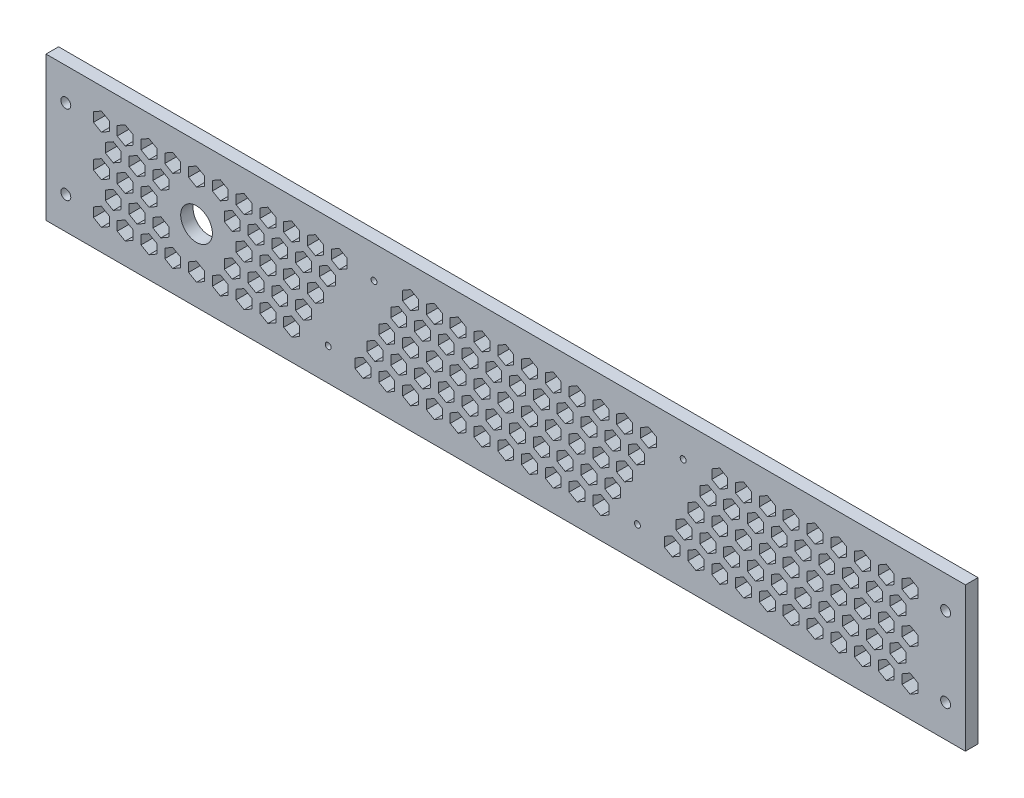
from build123d import *

# Parameters (mm, degrees)
SKETCH1_W           = 463.88
SKETCH1_H           = 72.7
BOSS_EXTRUDE1_DEPTH = 6.35
SKETCH4_R           = 2.5
CUT_EXTRUDE3_DEPTH  = 449.658653544
SKETCH5_W           = 423.88
SKETCH5_H           = 60
CUT_EXTRUDE4_DEPTH  = 0.1
FILL_START          = 192.1
FILL_PATTERN1_DEPTH = 6.25
SKETCH7_R           = 8
CUT_EXTRUDE5_DEPTH  = 449.658653544
SKETCH8_R           = 1.5
CUT_EXTRUDE6_DEPTH  = 449.658653544


with BuildPart() as part:
    # Sketch1 → Boss-Extrude1 (new body)
    with BuildSketch(Plane.XY.offset(192)):
        with Locations((211.74, 30)):
            Rectangle(SKETCH1_W, SKETCH1_H)
    extrude(amount=BOSS_EXTRUDE1_DEPTH)

    # Sketch4 → Cut-Extrude3 (cut, through all)
    with BuildSketch(Plane.XY.offset(198.35)):
        with Locations((-10.2, 50)):
            Circle(SKETCH4_R)
        with Locations((-10.2, 10)):
            Circle(SKETCH4_R)
        with Locations((433.68, 50)):
            Circle(SKETCH4_R)
        with Locations((433.68, 10)):
            Circle(SKETCH4_R)
    extrude(amount=-CUT_EXTRUDE3_DEPTH, mode=Mode.SUBTRACT)

    # Sketch5 → Cut-Extrude4 (cut)
    with BuildSketch(Plane(origin=(0, 0, 192), x_dir=(-1, 0, 0), z_dir=(0, 0, -1))):
        with Locations((-211.74, 30)):
            Rectangle(SKETCH5_W, SKETCH5_H)
    extrude(amount=-CUT_EXTRUDE4_DEPTH, mode=Mode.SUBTRACT)

    # Fill Pattern1: read off the stored shape, not the designer's step
    # Fill Pattern1 outline → Fill Pattern1 (cut)
    with BuildSketch(Plane.XY.offset(FILL_START)):
        Polygon((7.74, 4.596588156), (11.74, 6.905989232), (11.74, 11.524791386), (7.74, 13.834192463), (3.74, 11.524791386), (3.74, 6.905989232), align=None)
        Polygon((79.74, 46.165807537), (83.74, 48.475208614), (83.74, 53.094010768), (79.74, 55.403411844), (75.74, 53.094010768), (75.74, 48.475208614), align=None)
        Polygon((25.74, 14.988893001), (29.74, 17.298294078), (29.74, 21.917096231), (25.74, 24.226497308), (21.74, 21.917096231), (21.74, 17.298294078), align=None)
        Polygon((3.74, 53.094010768), (3.74, 48.475208614), (7.74, 46.165807537), (11.74, 48.475208614), (11.74, 53.094010768), (7.74, 55.403411844), align=None)
        Polygon((3.74, 32.309401077), (3.74, 27.690598923), (7.74, 25.381197846), (11.74, 27.690598923), (11.74, 32.309401077), (7.74, 34.618802153), align=None)
        Polygon((415.74, 4.596588156), (419.74, 6.905989232), (419.74, 11.524791386), (415.74, 13.834192463), (411.74, 11.524791386), (411.74, 6.905989232), align=None)
        Polygon((357.74, 38.082903769), (361.74, 35.773502692), (365.74, 38.082903769), (365.74, 42.701705922), (361.74, 45.011106999), (357.74, 42.701705922), align=None)
        Polygon((339.74, 48.475208614), (343.74, 46.165807537), (347.74, 48.475208614), (347.74, 53.094010768), (343.74, 55.403411844), (339.74, 53.094010768), align=None)
        Polygon((393.74, 17.298294078), (397.74, 14.988893001), (401.74, 17.298294078), (401.74, 21.917096231), (397.74, 24.226497308), (393.74, 21.917096231), align=None)
        Polygon((375.74, 27.690598923), (379.74, 25.381197846), (383.74, 27.690598923), (383.74, 32.309401077), (379.74, 34.618802153), (375.74, 32.309401077), align=None)
        Polygon((411.74, 53.094010768), (411.74, 48.475208614), (415.74, 46.165807537), (419.74, 48.475208614), (419.74, 53.094010768), (415.74, 55.403411844), align=None)
        Polygon((411.74, 32.309401077), (411.74, 27.690598923), (415.74, 25.381197846), (419.74, 27.690598923), (419.74, 32.309401077), (415.74, 34.618802153), align=None)
        Polygon((403.74, 4.596588156), (407.74, 6.905989232), (407.74, 11.524791386), (403.74, 13.834192463), (399.74, 11.524791386), (399.74, 6.905989232), align=None)
        Polygon((345.74, 38.082903769), (349.74, 35.773502692), (353.74, 38.082903769), (353.74, 42.701705922), (349.74, 45.011106999), (345.74, 42.701705922), align=None)
        Polygon((327.74, 48.475208614), (331.74, 46.165807537), (335.74, 48.475208614), (335.74, 53.094010768), (331.74, 55.403411844), (327.74, 53.094010768), align=None)
        Polygon((381.74, 17.298294078), (385.74, 14.988893001), (389.74, 17.298294078), (389.74, 21.917096231), (385.74, 24.226497308), (381.74, 21.917096231), align=None)
        Polygon((363.74, 27.690598923), (367.74, 25.381197846), (371.74, 27.690598923), (371.74, 32.309401077), (367.74, 34.618802153), (363.74, 32.309401077), align=None)
        Polygon((399.74, 53.094010768), (399.74, 48.475208614), (403.74, 46.165807537), (407.74, 48.475208614), (407.74, 53.094010768), (403.74, 55.403411844), align=None)
        Polygon((399.74, 32.309401077), (399.74, 27.690598923), (403.74, 25.381197846), (407.74, 27.690598923), (407.74, 32.309401077), (403.74, 34.618802153), align=None)
        Polygon((391.74, 4.596588156), (395.74, 6.905989232), (395.74, 11.524791386), (391.74, 13.834192463), (387.74, 11.524791386), (387.74, 6.905989232), align=None)
        Polygon((409.74, 14.988893001), (413.74, 17.298294078), (413.74, 21.917096231), (409.74, 24.226497308), (405.74, 21.917096231), (405.74, 17.298294078), align=None)
        Polygon((333.74, 38.082903769), (337.74, 35.773502692), (341.74, 38.082903769), (341.74, 42.701705922), (337.74, 45.011106999), (333.74, 42.701705922), align=None)
        Polygon((315.74, 48.475208614), (319.74, 46.165807537), (323.74, 48.475208614), (323.74, 53.094010768), (319.74, 55.403411844), (315.74, 53.094010768), align=None)
        Polygon((369.74, 17.298294078), (373.74, 14.988893001), (377.74, 17.298294078), (377.74, 21.917096231), (373.74, 24.226497308), (369.74, 21.917096231), align=None)
        Polygon((351.74, 27.690598923), (355.74, 25.381197846), (359.74, 27.690598923), (359.74, 32.309401077), (355.74, 34.618802153), (351.74, 32.309401077), align=None)
        Polygon((387.74, 53.094010768), (387.74, 48.475208614), (391.74, 46.165807537), (395.74, 48.475208614), (395.74, 53.094010768), (391.74, 55.403411844), align=None)
        Polygon((387.74, 32.309401077), (387.74, 27.690598923), (391.74, 25.381197846), (395.74, 27.690598923), (395.74, 32.309401077), (391.74, 34.618802153), align=None)
        Polygon((379.74, 4.596588156), (383.74, 6.905989232), (383.74, 11.524791386), (379.74, 13.834192463), (375.74, 11.524791386), (375.74, 6.905989232), align=None)
        Polygon((321.74, 38.082903769), (325.74, 35.773502692), (329.74, 38.082903769), (329.74, 42.701705922), (325.74, 45.011106999), (321.74, 42.701705922), align=None)
        Polygon((357.74, 17.298294078), (361.74, 14.988893001), (365.74, 17.298294078), (365.74, 21.917096231), (361.74, 24.226497308), (357.74, 21.917096231), align=None)
        Polygon((339.74, 27.690598923), (343.74, 25.381197846), (347.74, 27.690598923), (347.74, 32.309401077), (343.74, 34.618802153), (339.74, 32.309401077), align=None)
        Polygon((375.74, 53.094010768), (375.74, 48.475208614), (379.74, 46.165807537), (383.74, 48.475208614), (383.74, 53.094010768), (379.74, 55.403411844), align=None)
        Polygon((367.74, 4.596588156), (371.74, 6.905989232), (371.74, 11.524791386), (367.74, 13.834192463), (363.74, 11.524791386), (363.74, 6.905989232), align=None)
        Polygon((309.74, 38.082903769), (313.74, 35.773502692), (317.74, 38.082903769), (317.74, 42.701705922), (313.74, 45.011106999), (309.74, 42.701705922), align=None)
        Polygon((345.74, 17.298294078), (349.74, 14.988893001), (353.74, 17.298294078), (353.74, 21.917096231), (349.74, 24.226497308), (345.74, 21.917096231), align=None)
        Polygon((327.74, 27.690598923), (331.74, 25.381197846), (335.74, 27.690598923), (335.74, 32.309401077), (331.74, 34.618802153), (327.74, 32.309401077), align=None)
        Polygon((363.74, 53.094010768), (363.74, 48.475208614), (367.74, 46.165807537), (371.74, 48.475208614), (371.74, 53.094010768), (367.74, 55.403411844), align=None)
        Polygon((355.74, 4.596588156), (359.74, 6.905989232), (359.74, 11.524791386), (355.74, 13.834192463), (351.74, 11.524791386), (351.74, 6.905989232), align=None)
        Polygon((409.74, 35.773502692), (413.74, 38.082903769), (413.74, 42.701705922), (409.74, 45.011106999), (405.74, 42.701705922), (405.74, 38.082903769), align=None)
        Polygon((279.74, 48.475208614), (283.74, 46.165807537), (287.74, 48.475208614), (287.74, 53.094010768), (283.74, 55.403411844), (279.74, 53.094010768), align=None)
        Polygon((333.74, 17.298294078), (337.74, 14.988893001), (341.74, 17.298294078), (341.74, 21.917096231), (337.74, 24.226497308), (333.74, 21.917096231), align=None)
        Polygon((315.74, 27.690598923), (319.74, 25.381197846), (323.74, 27.690598923), (323.74, 32.309401077), (319.74, 34.618802153), (315.74, 32.309401077), align=None)
        Polygon((351.74, 53.094010768), (351.74, 48.475208614), (355.74, 46.165807537), (359.74, 48.475208614), (359.74, 53.094010768), (355.74, 55.403411844), align=None)
        Polygon((343.74, 4.596588156), (347.74, 6.905989232), (347.74, 11.524791386), (343.74, 13.834192463), (339.74, 11.524791386), (339.74, 6.905989232), align=None)
        Polygon((397.74, 35.773502692), (401.74, 38.082903769), (401.74, 42.701705922), (397.74, 45.011106999), (393.74, 42.701705922), (393.74, 38.082903769), align=None)
        Polygon((267.74, 48.475208614), (271.74, 46.165807537), (275.74, 48.475208614), (275.74, 53.094010768), (271.74, 55.403411844), (267.74, 53.094010768), align=None)
        Polygon((321.74, 17.298294078), (325.74, 14.988893001), (329.74, 17.298294078), (329.74, 21.917096231), (325.74, 24.226497308), (321.74, 21.917096231), align=None)
        Polygon((303.74, 27.690598923), (307.74, 25.381197846), (311.74, 27.690598923), (311.74, 32.309401077), (307.74, 34.618802153), (303.74, 32.309401077), align=None)
        Polygon((331.74, 4.596588156), (335.74, 6.905989232), (335.74, 11.524791386), (331.74, 13.834192463), (327.74, 11.524791386), (327.74, 6.905989232), align=None)
        Polygon((385.74, 35.773502692), (389.74, 38.082903769), (389.74, 42.701705922), (385.74, 45.011106999), (381.74, 42.701705922), (381.74, 38.082903769), align=None)
        Polygon((273.74, 38.082903769), (277.74, 35.773502692), (281.74, 38.082903769), (281.74, 42.701705922), (277.74, 45.011106999), (273.74, 42.701705922), align=None)
        Polygon((255.74, 48.475208614), (259.74, 46.165807537), (263.74, 48.475208614), (263.74, 53.094010768), (259.74, 55.403411844), (255.74, 53.094010768), align=None)
        Polygon((309.74, 17.298294078), (313.74, 14.988893001), (317.74, 17.298294078), (317.74, 21.917096231), (313.74, 24.226497308), (309.74, 21.917096231), align=None)
        Polygon((319.74, 4.596588156), (323.74, 6.905989232), (323.74, 11.524791386), (319.74, 13.834192463), (315.74, 11.524791386), (315.74, 6.905989232), align=None)
        Polygon((373.74, 35.773502692), (377.74, 38.082903769), (377.74, 42.701705922), (373.74, 45.011106999), (369.74, 42.701705922), (369.74, 38.082903769), align=None)
        Polygon((261.74, 38.082903769), (265.74, 35.773502692), (269.74, 38.082903769), (269.74, 42.701705922), (265.74, 45.011106999), (261.74, 42.701705922), align=None)
        Polygon((243.74, 48.475208614), (247.74, 46.165807537), (251.74, 48.475208614), (251.74, 53.094010768), (247.74, 55.403411844), (243.74, 53.094010768), align=None)
        Polygon((297.74, 17.298294078), (301.74, 14.988893001), (305.74, 17.298294078), (305.74, 21.917096231), (301.74, 24.226497308), (297.74, 21.917096231), align=None)
        Polygon((307.74, 4.596588156), (311.74, 6.905989232), (311.74, 11.524791386), (307.74, 13.834192463), (303.74, 11.524791386), (303.74, 6.905989232), align=None)
        Polygon((249.74, 38.082903769), (253.74, 35.773502692), (257.74, 38.082903769), (257.74, 42.701705922), (253.74, 45.011106999), (249.74, 42.701705922), align=None)
        Polygon((231.74, 48.475208614), (235.74, 46.165807537), (239.74, 48.475208614), (239.74, 53.094010768), (235.74, 55.403411844), (231.74, 53.094010768), align=None)
        Polygon((267.74, 27.690598923), (271.74, 25.381197846), (275.74, 27.690598923), (275.74, 32.309401077), (271.74, 34.618802153), (267.74, 32.309401077), align=None)
        Polygon((295.74, 4.596588156), (299.74, 6.905989232), (299.74, 11.524791386), (295.74, 13.834192463), (291.74, 11.524791386), (291.74, 6.905989232), align=None)
        Polygon((237.74, 38.082903769), (241.74, 35.773502692), (245.74, 38.082903769), (245.74, 42.701705922), (241.74, 45.011106999), (237.74, 42.701705922), align=None)
        Polygon((219.74, 48.475208614), (223.74, 46.165807537), (227.74, 48.475208614), (227.74, 53.094010768), (223.74, 55.403411844), (219.74, 53.094010768), align=None)
        Polygon((255.74, 27.690598923), (259.74, 25.381197846), (263.74, 27.690598923), (263.74, 32.309401077), (259.74, 34.618802153), (255.74, 32.309401077), align=None)
        Polygon((259.74, 4.596588156), (263.74, 6.905989232), (263.74, 11.524791386), (259.74, 13.834192463), (255.74, 11.524791386), (255.74, 6.905989232), align=None)
        Polygon((201.74, 38.082903769), (205.74, 35.773502692), (209.74, 38.082903769), (209.74, 42.701705922), (205.74, 45.011106999), (201.74, 42.701705922), align=None)
        Polygon((183.74, 48.475208614), (187.74, 46.165807537), (191.74, 48.475208614), (191.74, 53.094010768), (187.74, 55.403411844), (183.74, 53.094010768), align=None)
        Polygon((237.74, 17.298294078), (241.74, 14.988893001), (245.74, 17.298294078), (245.74, 21.917096231), (241.74, 24.226497308), (237.74, 21.917096231), align=None)
        Polygon((219.74, 27.690598923), (223.74, 25.381197846), (227.74, 27.690598923), (227.74, 32.309401077), (223.74, 34.618802153), (219.74, 32.309401077), align=None)
        Polygon((247.74, 4.596588156), (251.74, 6.905989232), (251.74, 11.524791386), (247.74, 13.834192463), (243.74, 11.524791386), (243.74, 6.905989232), align=None)
        Polygon((265.74, 14.988893001), (269.74, 17.298294078), (269.74, 21.917096231), (265.74, 24.226497308), (261.74, 21.917096231), (261.74, 17.298294078), align=None)
        Polygon((189.74, 38.082903769), (193.74, 35.773502692), (197.74, 38.082903769), (197.74, 42.701705922), (193.74, 45.011106999), (189.74, 42.701705922), align=None)
        Polygon((171.74, 48.475208614), (175.74, 46.165807537), (179.74, 48.475208614), (179.74, 53.094010768), (175.74, 55.403411844), (171.74, 53.094010768), align=None)
        Polygon((225.74, 17.298294078), (229.74, 14.988893001), (233.74, 17.298294078), (233.74, 21.917096231), (229.74, 24.226497308), (225.74, 21.917096231), align=None)
        Polygon((207.74, 27.690598923), (211.74, 25.381197846), (215.74, 27.690598923), (215.74, 32.309401077), (211.74, 34.618802153), (207.74, 32.309401077), align=None)
        Polygon((243.74, 32.309401077), (243.74, 27.690598923), (247.74, 25.381197846), (251.74, 27.690598923), (251.74, 32.309401077), (247.74, 34.618802153), align=None)
        Polygon((235.74, 4.596588156), (239.74, 6.905989232), (239.74, 11.524791386), (235.74, 13.834192463), (231.74, 11.524791386), (231.74, 6.905989232), align=None)
        Polygon((253.74, 14.988893001), (257.74, 17.298294078), (257.74, 21.917096231), (253.74, 24.226497308), (249.74, 21.917096231), (249.74, 17.298294078), align=None)
        Polygon((177.74, 38.082903769), (181.74, 35.773502692), (185.74, 38.082903769), (185.74, 42.701705922), (181.74, 45.011106999), (177.74, 42.701705922), align=None)
        Polygon((159.74, 48.475208614), (163.74, 46.165807537), (167.74, 48.475208614), (167.74, 53.094010768), (163.74, 55.403411844), (159.74, 53.094010768), align=None)
        Polygon((213.74, 17.298294078), (217.74, 14.988893001), (221.74, 17.298294078), (221.74, 21.917096231), (217.74, 24.226497308), (213.74, 21.917096231), align=None)
        Polygon((195.74, 27.690598923), (199.74, 25.381197846), (203.74, 27.690598923), (203.74, 32.309401077), (199.74, 34.618802153), (195.74, 32.309401077), align=None)
        Polygon((231.74, 32.309401077), (231.74, 27.690598923), (235.74, 25.381197846), (239.74, 27.690598923), (239.74, 32.309401077), (235.74, 34.618802153), align=None)
        Polygon((223.74, 4.596588156), (227.74, 6.905989232), (227.74, 11.524791386), (223.74, 13.834192463), (219.74, 11.524791386), (219.74, 6.905989232), align=None)
        Polygon((165.74, 38.082903769), (169.74, 35.773502692), (173.74, 38.082903769), (173.74, 42.701705922), (169.74, 45.011106999), (165.74, 42.701705922), align=None)
        Polygon((201.74, 17.298294078), (205.74, 14.988893001), (209.74, 17.298294078), (209.74, 21.917096231), (205.74, 24.226497308), (201.74, 21.917096231), align=None)
        Polygon((183.74, 27.690598923), (187.74, 25.381197846), (191.74, 27.690598923), (191.74, 32.309401077), (187.74, 34.618802153), (183.74, 32.309401077), align=None)
        Polygon((211.74, 4.596588156), (215.74, 6.905989232), (215.74, 11.524791386), (211.74, 13.834192463), (207.74, 11.524791386), (207.74, 6.905989232), align=None)
        Polygon((153.74, 38.082903769), (157.74, 35.773502692), (161.74, 38.082903769), (161.74, 42.701705922), (157.74, 45.011106999), (153.74, 42.701705922), align=None)
        Polygon((189.74, 17.298294078), (193.74, 14.988893001), (197.74, 17.298294078), (197.74, 21.917096231), (193.74, 24.226497308), (189.74, 21.917096231), align=None)
        Polygon((171.74, 27.690598923), (175.74, 25.381197846), (179.74, 27.690598923), (179.74, 32.309401077), (175.74, 34.618802153), (171.74, 32.309401077), align=None)
        Polygon((207.74, 53.094010768), (207.74, 48.475208614), (211.74, 46.165807537), (215.74, 48.475208614), (215.74, 53.094010768), (211.74, 55.403411844), align=None)
        Polygon((199.74, 4.596588156), (203.74, 6.905989232), (203.74, 11.524791386), (199.74, 13.834192463), (195.74, 11.524791386), (195.74, 6.905989232), align=None)
        Polygon((123.74, 48.475208614), (127.74, 46.165807537), (131.74, 48.475208614), (131.74, 53.094010768), (127.74, 55.403411844), (123.74, 53.094010768), align=None)
        Polygon((177.74, 17.298294078), (181.74, 14.988893001), (185.74, 17.298294078), (185.74, 21.917096231), (181.74, 24.226497308), (177.74, 21.917096231), align=None)
        Polygon((159.74, 27.690598923), (163.74, 25.381197846), (167.74, 27.690598923), (167.74, 32.309401077), (163.74, 34.618802153), (159.74, 32.309401077), align=None)
        Polygon((195.74, 53.094010768), (195.74, 48.475208614), (199.74, 46.165807537), (203.74, 48.475208614), (203.74, 53.094010768), (199.74, 55.403411844), align=None)
        Polygon((13.74, 14.988893001), (17.74, 17.298294078), (17.74, 21.917096231), (13.74, 24.226497308), (9.74, 21.917096231), (9.74, 17.298294078), align=None)
        Polygon((31.74, 25.381197846), (35.74, 27.690598923), (35.74, 32.309401077), (31.74, 34.618802153), (27.74, 32.309401077), (27.74, 27.690598923), align=None)
        Polygon((67.74, 46.165807537), (71.74, 48.475208614), (71.74, 53.094010768), (67.74, 55.403411844), (63.74, 53.094010768), (63.74, 48.475208614), align=None)
        Polygon((27.74, 6.905989232), (31.74, 4.596588156), (35.74, 6.905989232), (35.74, 11.524791386), (31.74, 13.834192463), (27.74, 11.524791386), align=None)
        Polygon((9.74, 42.701705922), (9.74, 38.082903769), (13.74, 35.773502692), (17.74, 38.082903769), (17.74, 42.701705922), (13.74, 45.011106999), align=None)
        Polygon((31.74, 46.165807537), (35.74, 48.475208614), (35.74, 53.094010768), (31.74, 55.403411844), (27.74, 53.094010768), (27.74, 48.475208614), align=None)
        Polygon((63.74, 6.905989232), (67.74, 4.596588156), (71.74, 6.905989232), (71.74, 11.524791386), (67.74, 13.834192463), (63.74, 11.524791386), align=None)
        Polygon((25.74, 35.773502692), (29.74, 38.082903769), (29.74, 42.701705922), (25.74, 45.011106999), (21.74, 42.701705922), (21.74, 38.082903769), align=None)
        Polygon((43.74, 46.165807537), (47.74, 48.475208614), (47.74, 53.094010768), (43.74, 55.403411844), (39.74, 53.094010768), (39.74, 48.475208614), align=None)
        Polygon((75.74, 6.905989232), (79.74, 4.596588156), (83.74, 6.905989232), (83.74, 11.524791386), (79.74, 13.834192463), (75.74, 11.524791386), align=None)
        Polygon((37.74, 35.773502692), (41.74, 38.082903769), (41.74, 42.701705922), (37.74, 45.011106999), (33.74, 42.701705922), (33.74, 38.082903769), align=None)
        Polygon((19.74, 25.381197846), (23.74, 27.690598923), (23.74, 32.309401077), (19.74, 34.618802153), (15.74, 32.309401077), (15.74, 27.690598923), align=None)
        Polygon((55.74, 46.165807537), (59.74, 48.475208614), (59.74, 53.094010768), (55.74, 55.403411844), (51.74, 53.094010768), (51.74, 48.475208614), align=None)
        Polygon((15.74, 48.475208614), (19.74, 46.165807537), (23.74, 48.475208614), (23.74, 53.094010768), (19.74, 55.403411844), (15.74, 53.094010768), align=None)
        Polygon((87.74, 6.905989232), (91.74, 4.596588156), (95.74, 6.905989232), (95.74, 11.524791386), (91.74, 13.834192463), (87.74, 11.524791386), align=None)
        Polygon((69.74, 17.298294078), (73.74, 14.988893001), (77.74, 17.298294078), (77.74, 21.917096231), (73.74, 24.226497308), (69.74, 21.917096231), align=None)
        Polygon((33.74, 21.917096231), (33.74, 17.298294078), (37.74, 14.988893001), (41.74, 17.298294078), (41.74, 21.917096231), (37.74, 24.226497308), align=None)
        Polygon((73.74, 35.773502692), (77.74, 38.082903769), (77.74, 42.701705922), (73.74, 45.011106999), (69.74, 42.701705922), (69.74, 38.082903769), align=None)
        Polygon((19.74, 4.596588156), (23.74, 6.905989232), (23.74, 11.524791386), (19.74, 13.834192463), (15.74, 11.524791386), (15.74, 6.905989232), align=None)
        Polygon((91.74, 46.165807537), (95.74, 48.475208614), (95.74, 53.094010768), (91.74, 55.403411844), (87.74, 53.094010768), (87.74, 48.475208614), align=None)
        Polygon((87.74, 27.690598923), (91.74, 25.381197846), (95.74, 27.690598923), (95.74, 32.309401077), (91.74, 34.618802153), (87.74, 32.309401077), align=None)
        Polygon((105.74, 17.298294078), (109.74, 14.988893001), (113.74, 17.298294078), (113.74, 21.917096231), (109.74, 24.226497308), (105.74, 21.917096231), align=None)
        Polygon((85.74, 35.773502692), (89.74, 38.082903769), (89.74, 42.701705922), (85.74, 45.011106999), (81.74, 42.701705922), (81.74, 38.082903769), align=None)
        Polygon((103.74, 46.165807537), (107.74, 48.475208614), (107.74, 53.094010768), (103.74, 55.403411844), (99.74, 53.094010768), (99.74, 48.475208614), align=None)
        Polygon((135.74, 6.905989232), (139.74, 4.596588156), (143.74, 6.905989232), (143.74, 11.524791386), (139.74, 13.834192463), (135.74, 11.524791386), align=None)
        Polygon((99.74, 27.690598923), (103.74, 25.381197846), (107.74, 27.690598923), (107.74, 32.309401077), (103.74, 34.618802153), (99.74, 32.309401077), align=None)
        Polygon((81.74, 21.917096231), (81.74, 17.298294078), (85.74, 14.988893001), (89.74, 17.298294078), (89.74, 21.917096231), (85.74, 24.226497308), align=None)
        Polygon((97.74, 35.773502692), (101.74, 38.082903769), (101.74, 42.701705922), (97.74, 45.011106999), (93.74, 42.701705922), (93.74, 38.082903769), align=None)
        Polygon((115.74, 46.165807537), (119.74, 48.475208614), (119.74, 53.094010768), (115.74, 55.403411844), (111.74, 53.094010768), (111.74, 48.475208614), align=None)
        Polygon((43.74, 4.596588156), (47.74, 6.905989232), (47.74, 11.524791386), (43.74, 13.834192463), (39.74, 11.524791386), (39.74, 6.905989232), align=None)
        Polygon((79.74, 25.381197846), (83.74, 27.690598923), (83.74, 32.309401077), (79.74, 34.618802153), (75.74, 32.309401077), (75.74, 27.690598923), align=None)
        Polygon((147.74, 6.905989232), (151.74, 4.596588156), (155.74, 6.905989232), (155.74, 11.524791386), (151.74, 13.834192463), (147.74, 11.524791386), align=None)
        Polygon((111.74, 27.690598923), (115.74, 25.381197846), (119.74, 27.690598923), (119.74, 32.309401077), (115.74, 34.618802153), (111.74, 32.309401077), align=None)
        Polygon((93.74, 21.917096231), (93.74, 17.298294078), (97.74, 14.988893001), (101.74, 17.298294078), (101.74, 21.917096231), (97.74, 24.226497308), align=None)
        Polygon((109.74, 35.773502692), (113.74, 38.082903769), (113.74, 42.701705922), (109.74, 45.011106999), (105.74, 42.701705922), (105.74, 38.082903769), align=None)
        Polygon((55.74, 4.596588156), (59.74, 6.905989232), (59.74, 11.524791386), (55.74, 13.834192463), (51.74, 11.524791386), (51.74, 6.905989232), align=None)
        Polygon((159.74, 6.905989232), (163.74, 4.596588156), (167.74, 6.905989232), (167.74, 11.524791386), (163.74, 13.834192463), (159.74, 11.524791386), align=None)
        Polygon((141.74, 17.298294078), (145.74, 14.988893001), (149.74, 17.298294078), (149.74, 21.917096231), (145.74, 24.226497308), (141.74, 21.917096231), align=None)
        Polygon((121.74, 35.773502692), (125.74, 38.082903769), (125.74, 42.701705922), (121.74, 45.011106999), (117.74, 42.701705922), (117.74, 38.082903769), align=None)
        Polygon((153.74, 17.298294078), (157.74, 14.988893001), (161.74, 17.298294078), (161.74, 21.917096231), (157.74, 24.226497308), (153.74, 21.917096231), align=None)
        Polygon((171.74, 6.905989232), (175.74, 4.596588156), (179.74, 6.905989232), (179.74, 11.524791386), (175.74, 13.834192463), (171.74, 11.524791386), align=None)
        Polygon((103.74, 4.596588156), (107.74, 6.905989232), (107.74, 11.524791386), (103.74, 13.834192463), (99.74, 11.524791386), (99.74, 6.905989232), align=None)
        Polygon((151.74, 25.381197846), (155.74, 27.690598923), (155.74, 32.309401077), (151.74, 34.618802153), (147.74, 32.309401077), (147.74, 27.690598923), align=None)
        Polygon((165.74, 21.917096231), (165.74, 17.298294078), (169.74, 14.988893001), (173.74, 17.298294078), (173.74, 21.917096231), (169.74, 24.226497308), align=None)
        Polygon((217.74, 35.773502692), (221.74, 38.082903769), (221.74, 42.701705922), (217.74, 45.011106999), (213.74, 42.701705922), (213.74, 38.082903769), align=None)
        Polygon((229.74, 35.773502692), (233.74, 38.082903769), (233.74, 42.701705922), (229.74, 45.011106999), (225.74, 42.701705922), (225.74, 38.082903769), align=None)
        Polygon((187.74, 4.596588156), (191.74, 6.905989232), (191.74, 11.524791386), (187.74, 13.834192463), (183.74, 11.524791386), (183.74, 6.905989232), align=None)
    extrude(amount=FILL_PATTERN1_DEPTH, mode=Mode.SUBTRACT)

    # Sketch7 → Cut-Extrude5 (cut, through all)
    with BuildSketch(Plane.XY.offset(198.35)):
        with Locations((55.74, 30)):
            Circle(SKETCH7_R)
    extrude(amount=-CUT_EXTRUDE5_DEPTH, mode=Mode.SUBTRACT)

    # Sketch8 → Cut-Extrude6 (cut, through all)
    with BuildSketch(Plane.XY.offset(198.35)):
        with Locations((122.192994616, 10)):
            Circle(SKETCH8_R)
        with Locations((145.287005384, 50)):
            Circle(SKETCH8_R)
        with Locations((301.287005384, 50)):
            Circle(SKETCH8_R)
        with Locations((278.192994616, 10)):
            Circle(SKETCH8_R)
    extrude(amount=-CUT_EXTRUDE6_DEPTH, mode=Mode.SUBTRACT)


solid = part.part
